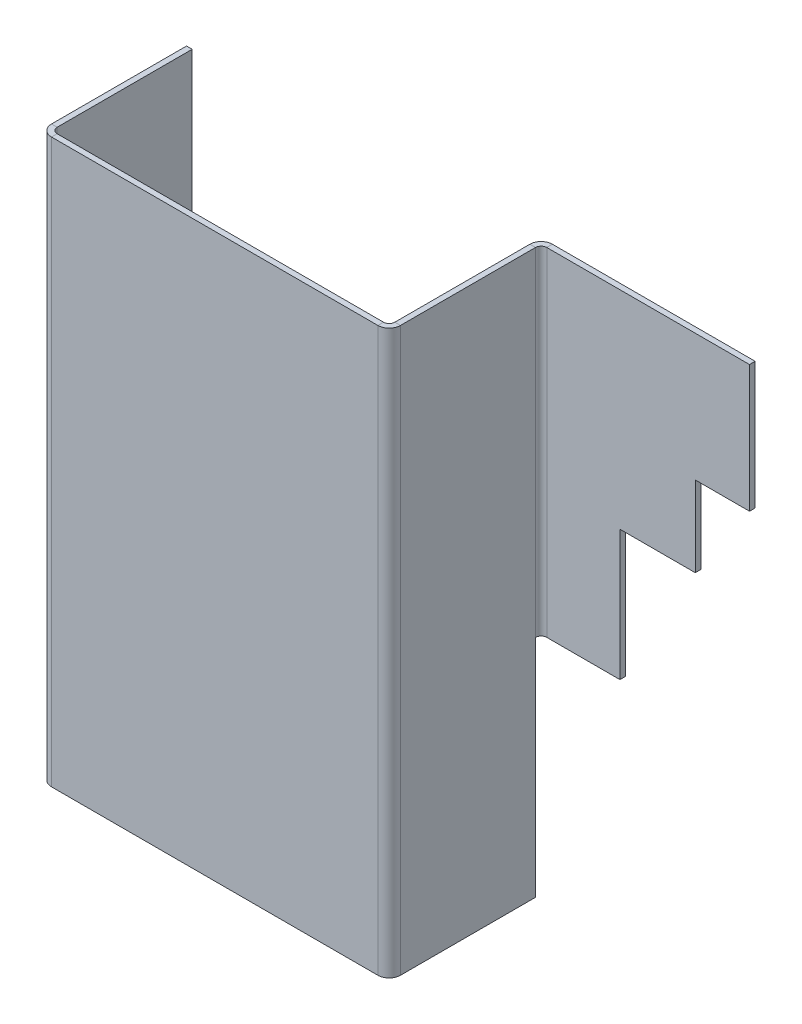
from build123d import *

# Parameters (mm, degrees)
Z_KLADN_PLECH1_DEPTH = 100
LEM_Z_HRANY1_DEPTH   = 60
OU_KO1_DEPTH         = 1


# Sheet-metal steps are written as plain solids
with BuildPart() as part:
    # Skica1 → Základní plech1 (new body)
    with BuildSketch(Plane(origin=(0, 0, 0), x_dir=(1, 0, 0), z_dir=(0, 1, 0))):
        with BuildLine():
            Line((0, 25), (0, 1))
            ThreePointArc((0, 1), (0.292893219, 0.292893219), (1, 0))
            Line((1, 0), (59, 0))
            ThreePointArc((59, 0), (59.707106781, 0.292893219), (60, 1))
            Line((60, 1), (60, 25))
            Line((60, 25), (61, 25))
            Line((61, 25), (61, 1))
            ThreePointArc((61, 1), (60.414213562, -0.414213562), (59, -1))
            Line((59, -1), (1, -1))
            ThreePointArc((1, -1), (-0.414213562, -0.414213562), (-1, 1))
            Line((-1, 1), (-1, 25))
            Line((-1, 25), (0, 25))
        make_face()
    extrude(amount=Z_KLADN_PLECH1_DEPTH)

    # Lem z hrany1 section (across the edge) → Lem z hrany1 (add)
    with BuildSketch(Plane(origin=(61, 40, -26), x_dir=(0, 0, 1), z_dir=(0, 1, 0))):
        with BuildLine():
            Line((-1, 1), (-1, 14))
            Line((-1, 14), (0, 14))
            Line((0, 14), (0, 1))
            ThreePointArc((0, 1), (0.292893219, 0.292893219), (1, 0))
            Line((1, 0), (1, -1))
            ThreePointArc((1, -1), (-0.414213562, -0.414213562), (-1, 1))
        make_face()
    extrude(amount=LEM_Z_HRANY1_DEPTH)

    # Skica9 → Ouško1 (add)
    with BuildSketch(Plane(origin=(0, 0, -27), x_dir=(-1, 0, 0), z_dir=(0, 0, -1))):
        Polygon((-98.025768087, 100), (-75, 100), (-75, 63.144926654), (-88.390120494, 63.144926654), (-88.390120494, 77.419960125), (-98.025768087, 77.419960125), align=None)
    extrude(amount=-OU_KO1_DEPTH)


solid = part.part
